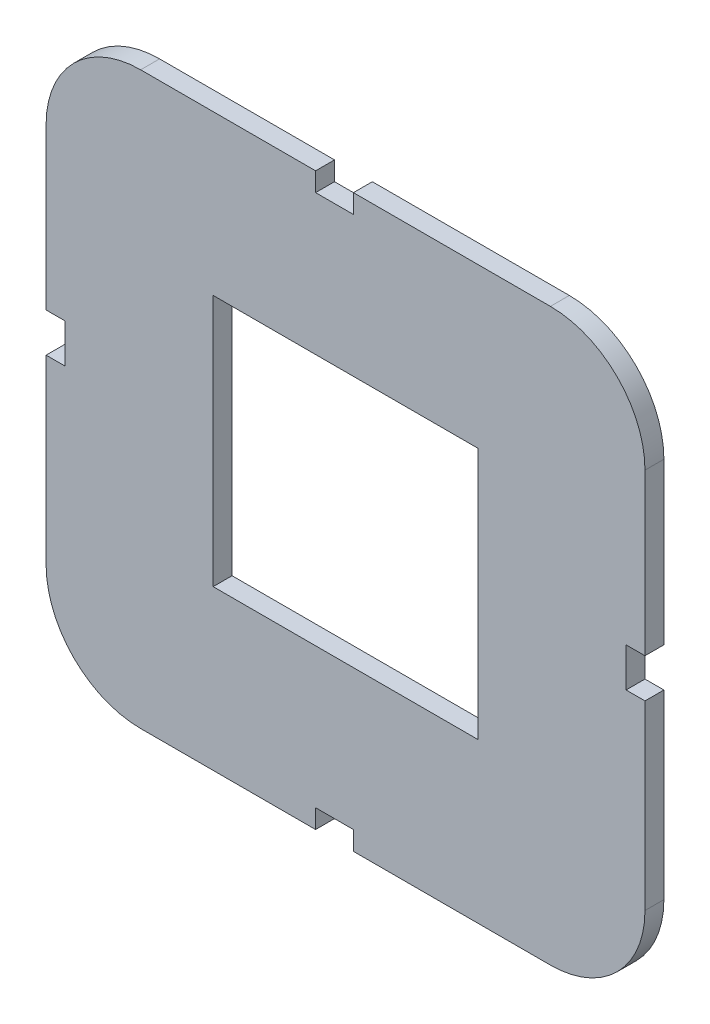
from build123d import *

# Parameters (mm, degrees)
SKETCH1_W           = 42
SKETCH1_H           = 40.010526316
BOSS_EXTRUDE1_DEPTH = 3


with BuildPart() as part:
    # Sketch1 → Boss-Extrude1 (new body)
    with BuildSketch(Plane.XY):
        with BuildLine():
            Line((-47.5, -1.45), (-44.5, -1.45))
            Line((-44.5, -1.45), (-44.5, 4.75))
            Line((-44.5, 4.75), (-47.5, 4.75))
            Line((-47.5, 4.75), (-47.5, 30.25))
            ThreePointArc((-47.5, 30.25), (-43.106601718, 40.856601718), (-32.5, 45.25))
            Line((-32.5, 45.25), (-4.75, 45.25))
            Line((-4.75, 45.25), (-4.75, 42.25))
            Line((-4.75, 42.25), (1.25, 42.25))
            Line((1.25, 42.25), (1.25, 45.25))
            Line((1.25, 45.25), (32.5, 45.25))
            ThreePointArc((32.5, 45.25), (43.106601718, 40.856601718), (47.5, 30.25))
            Line((47.5, 30.25), (47.5, 4.75))
            Line((47.5, 4.75), (44.5, 4.75))
            Line((44.5, 4.75), (44.5, -1.45))
            Line((44.5, -1.45), (47.5, -1.45))
            Line((47.5, -1.45), (47.5, -30.25))
            ThreePointArc((47.5, -30.25), (43.106601718, -40.856601718), (32.5, -45.25))
            Line((32.5, -45.25), (1.25, -45.25))
            Line((1.25, -45.25), (1.25, -42.25))
            Line((1.25, -42.25), (-4.75, -42.25))
            Line((-4.75, -42.25), (-4.75, -45.25))
            Line((-4.75, -45.25), (-32.5, -45.25))
            ThreePointArc((-32.5, -45.25), (-43.106601718, -40.856601718), (-47.5, -30.25))
            Line((-47.5, -30.25), (-47.5, -1.45))
        make_face()
        Rectangle(SKETCH1_W, SKETCH1_H, mode=Mode.SUBTRACT)
    extrude(amount=BOSS_EXTRUDE1_DEPTH)


solid = part.part
